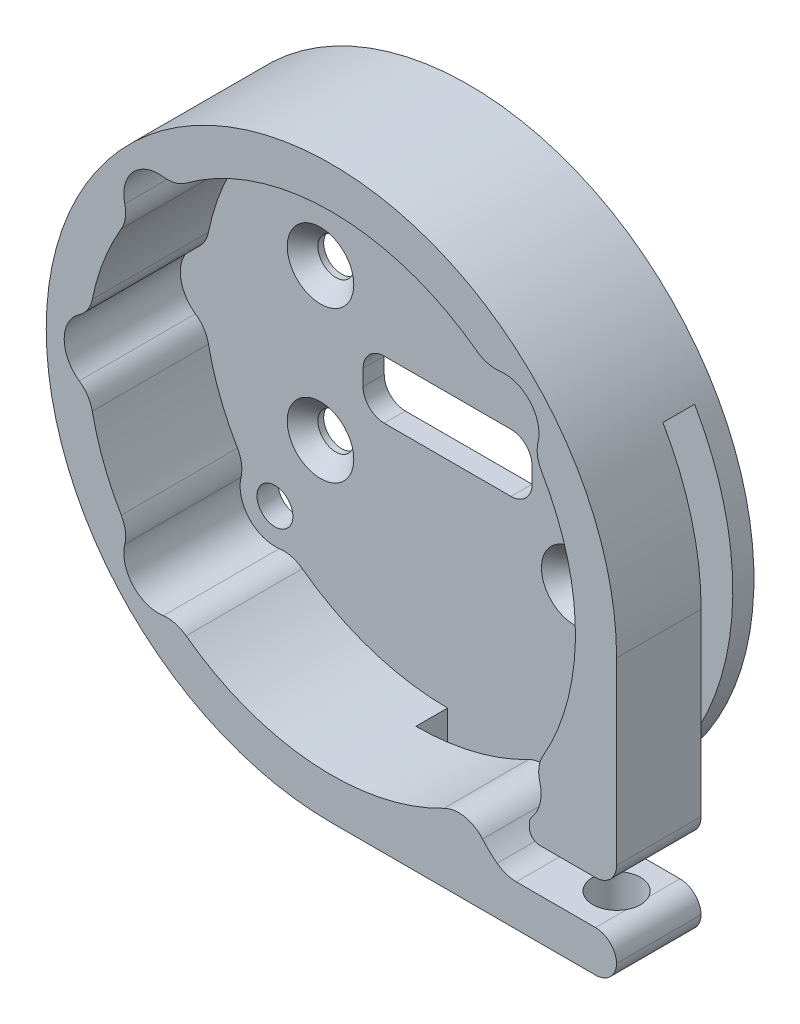
from build123d import *

# Parameters (mm, degrees)
SKETCH_1_R                   = 27
SKETCH_1_R_2                 = 23.1
EXTRUDE_1_DEPTH              = 11
EXTRUDE_START                = 2
SKETCH_2_R                   = 27
EXTRUDE_2_DEPTH              = 2
EXTRUDE_START_2              = -8
EXTRUDE_3_DEPTH              = 8
CUT_EXTRUDE_START            = -8
CUT_EXTRUDE_1_DEPTH          = 8
HOLE_WIZARD_M41_D            = 4.5
HOLE_WIZARD_M41_DEPTH        = 3.9
M4X0_71_D                    = 3.3
M4X0_71_DEPTH                = 10.5
M4X0_71_TIP                  = 0.991420021
CUT_EXTRUDE_START_2          = -3
CUT_EXTRUDE_2_DEPTH          = 3
FILLET_1_R                   = 2
SKETCH_11_W                  = 16
SKETCH_11_H                  = 5.5
CUT_EXTRUDE_3_DEPTH          = 40.736633068
SKETCH_15_R                  = 3.3
SKETCH_15_R_2                = 3.5
CUT_EXTRUDE_5_DEPTH          = 40.736633068
FILLET_3_R                   = 3
SKETCH_16_W                  = 6.088373552
SKETCH_16_H                  = 3.13806494
CUT_EXTRUDE_6_DEPTH          = 11
HOLE_WIZARD_M31_D            = 3.4
HOLE_WIZARD_M31_DEPTH        = 18
HOLE_WIZARD_M31_TIP          = 1.021463052
HOLE_WIZARD_M31_2_AT_2_COUNT = 2
HOLE_WIZARD_M31_2_AT_2_PITCH = 14.310111001
HOLE_WIZARD_M31_2_AT_3_COUNT = 2
HOLE_WIZARD_M31_2_AT_3_PITCH = 28
HOLE_WIZARD_M31_2_AT_4_COUNT = 2
HOLE_WIZARD_M31_2_AT_4_PITCH = 24.067004865
FILLET_7_R                   = 2
EXTRUDE_4_DEPTH              = 8
FILLET_8_R                   = 3
FILLET_9_R                   = 1


with BuildPart() as part:
    # Эскиз1 → Бобышка-Вытянуть1 (new body)
    with BuildSketch(Plane.XY):
        Circle(SKETCH_1_R)
        Circle(SKETCH_1_R_2, mode=Mode.SUBTRACT)
    extrude(amount=EXTRUDE_1_DEPTH)

    # Эскиз2 → Бобышка-Вытянуть2 (add)
    with BuildSketch(Plane(origin=(0, 0, 0), x_dir=(-1, 0, 0), z_dir=(0, 0, -1)).offset(EXTRUDE_START)):
        Circle(SKETCH_2_R)
    extrude(amount=-EXTRUDE_2_DEPTH)

    # Эскиз3 → Бобышка-Вытянуть3 (add)
    with BuildSketch(Plane.XY.offset(11).offset(EXTRUDE_START_2)):
        with BuildLine():
            Line((0, -27), (27, -27))
            Line((27, -27), (27, 0))
            ThreePointArc((27, 0), (19.091883092, -19.091883092), (0, -27))
        make_face()
    extrude(amount=EXTRUDE_3_DEPTH)

    # Эскиз4 → Вырез-Вытянуть1 (cut)
    with BuildSketch(Plane.XY.offset(11).offset(CUT_EXTRUDE_START)):
        with BuildLine():
            Line((0, -23.1), (27, -23.1))
            Line((27, -23.1), (27, -19))
            Line((27, -19), (13.138112498, -19))
            ThreePointArc((13.138112498, -19), (6.88149693, -22.051190444), (0, -23.1))
        make_face()
    extrude(amount=CUT_EXTRUDE_1_DEPTH, mode=Mode.SUBTRACT)

    # Отверстие с зазором M41
    with Locations(Plane(origin=(0, -27, 0), x_dir=(-1, 0, 0), z_dir=(0, -1, 0))):
        with Locations((-23, -7)):
            Hole(HOLE_WIZARD_M41_D / 2, depth=HOLE_WIZARD_M41_DEPTH)

    # Отверстие обработанное метчиком M4x0.71
    with Locations(Plane(origin=(0, -19, 0), x_dir=(-1, 0, 0), z_dir=(0, -1, 0))):
        with Locations((-23, -7)):
            Hole(M4X0_71_D / 2, depth=M4X0_71_DEPTH)
            with Locations((0, 0, -(M4X0_71_DEPTH + M4X0_71_TIP / 2))):  # 118° drill point
                Cone(0, M4X0_71_D / 2, M4X0_71_TIP, mode=Mode.SUBTRACT)

    # Эскиз10 → Вырез-Вытянуть2 (cut)
    with BuildSketch(Plane.XY.offset(3).offset(CUT_EXTRUDE_START_2)):
        with BuildLine():
            Line((20.005186827, 11.55), (23.382685902, 13.5))
            ThreePointArc((23.382685902, 13.5), (23.382685902, -13.5), (0, -27))
            Line((0, -27), (0, -23.1))
            ThreePointArc((0, -23.1), (20.005186827, -11.55), (20.005186827, 11.55))
        make_face()
    extrude(amount=CUT_EXTRUDE_2_DEPTH, mode=Mode.SUBTRACT)

    # Скругление1
    # the kernel refuses this fillet: 2 mm, written as the material it takes off along each edge
    with BuildSketch(Plane(origin=(27, -27, -2), x_dir=(-1, 0, 0), z_dir=(0, 0, 1)), Plane(origin=(27, -19, -2), x_dir=(-1, 0, 0), z_dir=(0, 0, 1))) as fillet_1_piece_1:
        with BuildLine():
            CenterArc((FILLET_1_R, -FILLET_1_R), FILLET_1_R, 90, 90)
            Line((0, -FILLET_1_R), (0, 0))
            Line((0, 0), (FILLET_1_R, 0))
        make_face()
    extrude(amount=18, mode=Mode.SUBTRACT)
    with BuildSketch(Plane(origin=(27, -23.1, -2), x_dir=(-1, 0, 0), z_dir=(0, 0, 1))) as fillet_1_piece_2:
        with BuildLine():
            CenterArc((FILLET_1_R, FILLET_1_R), FILLET_1_R, 180, 90)
            Line((0, FILLET_1_R), (0, 0))
            Line((0, 0), (FILLET_1_R, 0))
        make_face()
    extrude(amount=18, mode=Mode.SUBTRACT)

    # Эскиз11 → Вырез-Вытянуть3 (cut, through all)
    with BuildSketch(Plane.XY):
        Rectangle(SKETCH_11_W, SKETCH_11_H)
    extrude(amount=-CUT_EXTRUDE_3_DEPTH, mode=Mode.SUBTRACT)

    # Эскиз15 → Вырез-Вытянуть5 (cut, through all)
    with BuildSketch(Plane.XY):
        with Locations((-16.349186161, 14.72087334)):
            Circle(SKETCH_15_R)
        with Locations((16.349186161, 14.72087334)):
            Circle(SKETCH_15_R)
        with Locations((16.349186161, -14.72087334)):
            Circle(SKETCH_15_R_2)
        with Locations((-16.349186161, -14.72087334)):
            Circle(SKETCH_15_R)
        with Locations((-22, 0)):
            Circle(SKETCH_15_R)
    extrude(amount=CUT_EXTRUDE_5_DEPTH, mode=Mode.SUBTRACT)

    # Скругление3
    fillet_3_edges = [part.edges().sort_by_distance(p)[0] for p in [
        (-14.874981636, 17.673282698, 5.5),
        (-19.131325578, 12.946133849, 5.5),
        (19.131325578, 12.946133849, 5.5),
        (14.874981636, 17.673282698, 5.5),
        (19.252179639, -12.765718905, 7),
        (-19.131325578, -12.946133849, 5.5),
        (-14.874981636, -17.673282698, 5.5),
        (-22.88, 3.180503105, 5.5),
        (-22.88, -3.180503105, 5.5),
    ]]
    fillet(fillet_3_edges, radius=FILLET_3_R)

    # Эскиз16 → Вырез-Вытянуть6 (cut)
    with BuildSketch(Plane.XY.offset(11)):
        with Locations((15.687994571, -18.137334547)):
            Rectangle(SKETCH_16_W, SKETCH_16_H)
    extrude(amount=-CUT_EXTRUDE_6_DEPTH, mode=Mode.SUBTRACT)

    # Hole Wizard M31
    with Locations(Plane.XY):
        with Locations((-16.349186161, 14.72087334), (16.349186161, 14.72087334), (16.349186161, -14.72087334), (-16.349186161, -14.72087334)):
            Hole(HOLE_WIZARD_M31_D / 2, depth=HOLE_WIZARD_M31_DEPTH)
            with Locations((0, 0, -(HOLE_WIZARD_M31_DEPTH + HOLE_WIZARD_M31_TIP / 2))):  # 118° drill point
                Cone(0, HOLE_WIZARD_M31_D / 2, HOLE_WIZARD_M31_TIP, mode=Mode.SUBTRACT)

    # Эскиз19 → Hole Wizard M31 2 (revolve, cut)
    with BuildSketch(Plane(origin=(-12.033502432, 7.1550555, 0), x_dir=(0, -1, 0), z_dir=(1, 0, 0))):
        Polygon((0, 0), (0, 2), (1.7, 2), (1.7, 1.45), (3.15, 0), align=None)
    hole_wizard_m31_2 = revolve(axis=Axis((-12.033502432, 7.1550555, 6.35), (0, 0, -1)), mode=Mode.SUBTRACT)

    # Hole Wizard M31 2 at 2: Hole Wizard M31 2 ×2
    with Locations(*[(0, -i * HOLE_WIZARD_M31_2_AT_2_PITCH, 0) for i in range(1, HOLE_WIZARD_M31_2_AT_2_COUNT)]):
        add(hole_wizard_m31_2, mode=Mode.SUBTRACT)

    # Hole Wizard M31 2 at 3: Hole Wizard M31 2 ×2
    with Locations(*[Vector(0.859535888020661, -0.5110753928771503, 0) * (i * HOLE_WIZARD_M31_2_AT_3_PITCH) for i in range(1, HOLE_WIZARD_M31_2_AT_3_COUNT)]):
        add(hole_wizard_m31_2, mode=Mode.SUBTRACT)

    # Hole Wizard M31 2 at 4: Hole Wizard M31 2 ×2
    with Locations(*[(i * HOLE_WIZARD_M31_2_AT_4_PITCH, 0, 0) for i in range(1, HOLE_WIZARD_M31_2_AT_4_COUNT)]):
        add(hole_wizard_m31_2, mode=Mode.SUBTRACT)

    # Скругление7
    fillet_7_edges = [part.edges().sort_by_distance(p)[0] for p in [
        (8, 2.75, -1),
        (8, -2.75, -1),
        (-8, -2.75, -1),
        (-8, 2.75, -1),
    ]]
    fillet(fillet_7_edges, radius=FILLET_7_R)

    # Эскиз21 → Бобышка-Вытянуть4 (add)
    with BuildSketch(Plane.XY.offset(11).offset(EXTRUDE_START_2)):
        with BuildLine():
            Line((16.596130054, -23.1), (0, -23.1))
            ThreePointArc((0, -23.1), (6.777628995, -22.083336369), (12.958671938, -19.122835083))
            ThreePointArc((12.958671938, -19.122835083), (14.479457868, -21.383912063), (16.596130054, -23.1))
        make_face()
    extrude(amount=EXTRUDE_4_DEPTH)

    # Скругление8
    fillet_8_edges = [part.edges().sort_by_distance(p)[0] for p in [
        (16.596130054, -23.1, 7),
        (12.958671938, -19.122835083, 7),
    ]]
    fillet(fillet_8_edges, radius=FILLET_8_R)

    # Скругление9
    fillet_9_edges = [part.edges().sort_by_distance(p)[0] for p in [
        (18.732181347, -17.28433466, 7),
        (18.732181347, -19, 7),
    ]]
    fillet(fillet_9_edges, radius=FILLET_9_R)


solid = part.part
